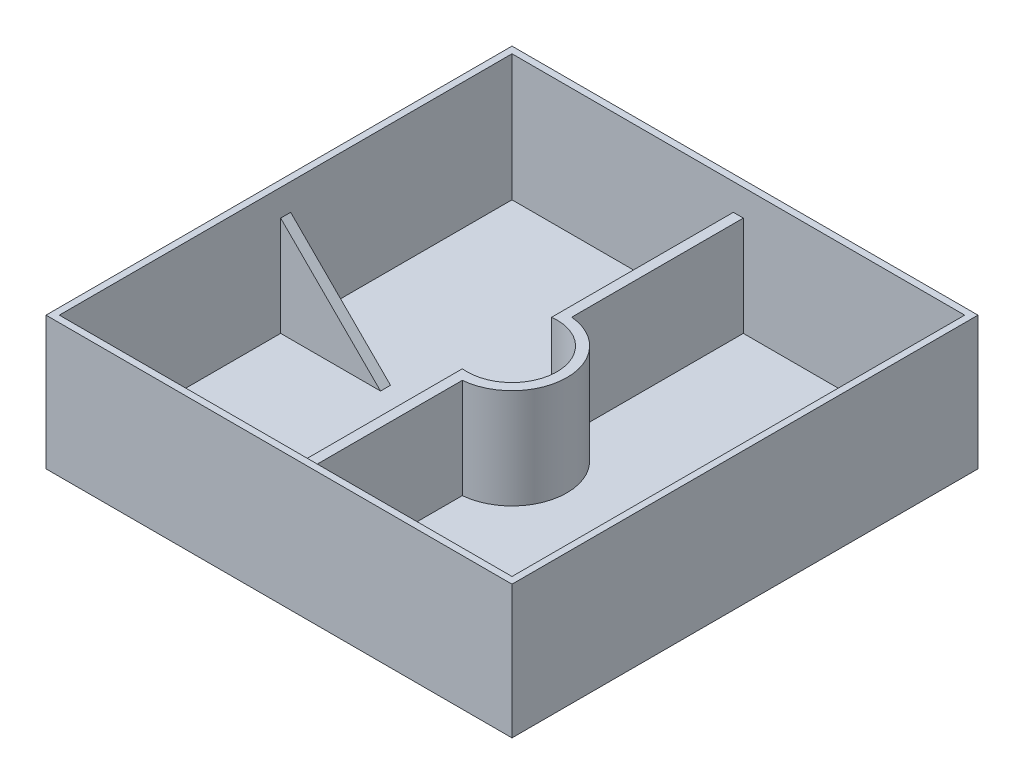
from build123d import *

# Parameters (mm, degrees)
SKETCH1_W           = 177.8
SKETCH1_H           = 177.8
BOSS_EXTRUDE1_DEPTH = 50.8
SHELL1_T            = -2.54
RIB2_REACH          = 137.599
SKETCH2_WALL_W      = 327.079324328
SKETCH2_WALL_H      = 3.81
RIB3_REACH          = 134.129


with BuildPart() as part:
    # Sketch1 → Boss-Extrude1 (new body)
    with BuildSketch(Plane(origin=(0, 0, 0), x_dir=(1, 0, 0), z_dir=(0, 1, 0))):
        Rectangle(SKETCH1_W, SKETCH1_H)
    extrude(amount=BOSS_EXTRUDE1_DEPTH)

    # Shell1
    shell1_openings = [part.faces().sort_by_distance(p)[0] for p in [
        (0, 50.8, 0),
    ]]
    offset(amount=SHELL1_T, openings=shell1_openings, kind=Kind.INTERSECTION)

    # Sketch2 wall → Rib2 (add, up to next)
    with BuildSketch(Plane(origin=(-67.31, 21.59, 0), x_dir=(0.707106781187, -0.707106781187, 0), z_dir=(0.707106781187, 0.707106781187, 0)), mode=Mode.PRIVATE) as rib2_sk1:
        Rectangle(SKETCH2_WALL_W, SKETCH2_WALL_H)
    rib2_tool1 = extrude(rib2_sk1.sketch, amount=-RIB2_REACH, mode=Mode.PRIVATE) - part.part
    rib2 = rib2_tool1.solids().sort_by_distance((-67.31, 21.59, 0))[0]
    add(rib2)

    # Mirror1: Rib2 across plane
    add(rib2.mirror(Plane(origin=(0, 0, 0), x_dir=(0, 0, 1), z_dir=(1, 0, 0))))

    # Sketch3 walls → Rib3 (add, up to next)
    with BuildSketch(Plane(origin=(0, 40.64, 0), x_dir=(1, 0, 0), z_dir=(0, 1, 0)), mode=Mode.PRIVATE) as rib3_sk1:
        with BuildLine():
            Line((1.905, -219.488837125), (1.905, -20.868229441))
            ThreePointArc((1.905, -20.868229441), (20.955, 0), (1.905, 20.868229441))
            Line((1.905, 20.868229441), (1.905, 219.488837125))
            Line((1.905, 219.488837125), (-1.905, 219.488837125))
            Line((-1.905, 219.488837125), (-1.905, 17.038837989))
            ThreePointArc((-1.905, 17.038837989), (17.145, 0), (-1.905, -17.038837989))
            Line((-1.905, -17.038837989), (-1.905, -219.488837125))
            Line((-1.905, -219.488837125), (1.905, -219.488837125))
        make_face()
    rib3_tool1 = extrude(rib3_sk1.sketch, amount=-RIB3_REACH, mode=Mode.PRIVATE) - part.part
    add(rib3_tool1.solids().sort_by_distance((19.05, 40.64, 0))[0])


solid = part.part
